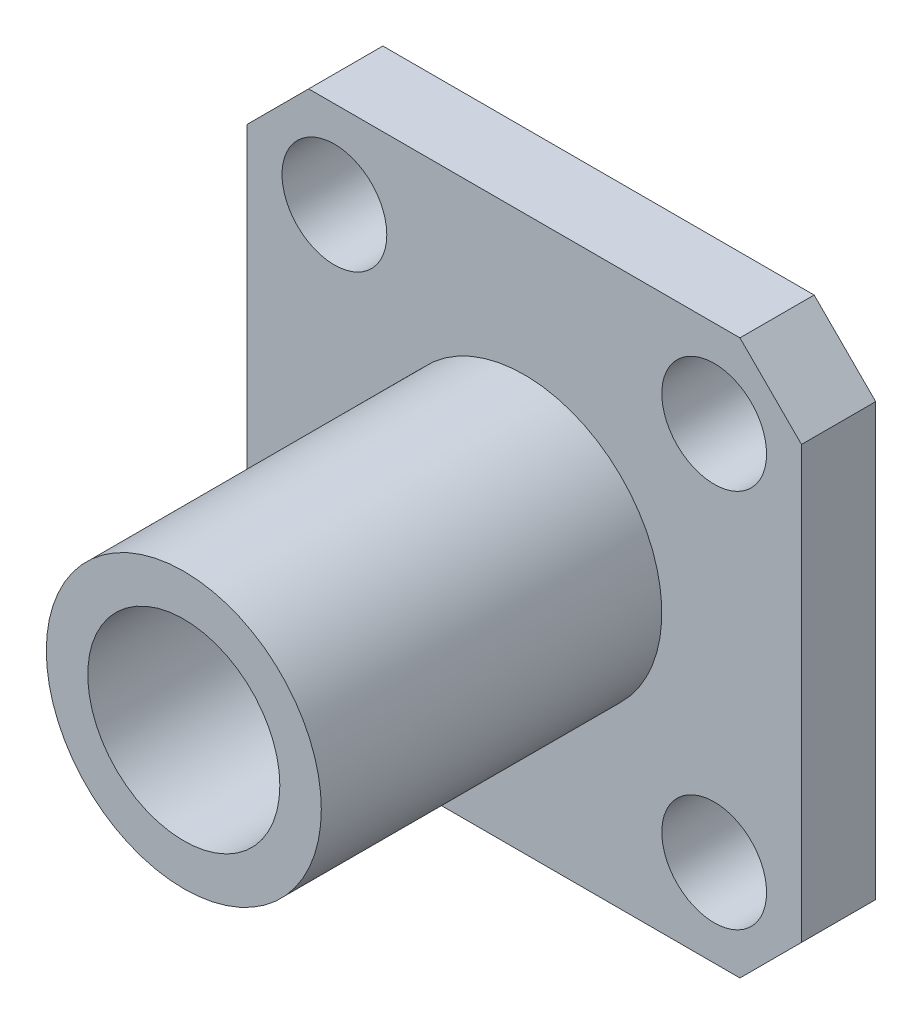
from build123d import *

# Parameters (mm, degrees)
SKETCH1_W           = 12.7
SKETCH1_H           = 12.7
BOSS_EXTRUDE1_DEPTH = 1.7
CHAMFER3_SIZE       = 1.41
SKETCH2_R           = 1.2
CUT_EXTRUDE2_DEPTH  = 10.139748355
SKETCH3_R           = 3.15
SKETCH3_R_2         = 2.2
BOSS_EXTRUDE2_DEPTH = 7.8
SKETCH4_R           = 0.64
BOSS_EXTRUDE3_DEPTH = 5


with BuildPart() as part:
    # Sketch1 → Boss-Extrude1 (new body)
    with BuildSketch(Plane(origin=(0, 0, 0), x_dir=(0, 1, 0), z_dir=(0, 0, 1))):
        Rectangle(SKETCH1_W, SKETCH1_H)
    extrude(amount=BOSS_EXTRUDE1_DEPTH)

    # Chamfer3
    chamfer3_edges = [part.edges().sort_by_distance(p)[0] for p in [
        (-6.35, 6.35, 0.85),
        (6.35, 6.35, 0.85),
        (6.35, -6.35, 0.85),
        (-6.35, -6.35, 0.85),
    ]]
    chamfer(chamfer3_edges, length=CHAMFER3_SIZE)

    # Sketch2 → Cut-Extrude2 (cut, through all)
    with BuildSketch(Plane.XY.offset(1.7)):
        with Locations((-4.35, 4.35)):
            Circle(SKETCH2_R)
        with Locations((-4.35, -4.35)):
            Circle(SKETCH2_R)
        with Locations((4.35, -4.35)):
            Circle(SKETCH2_R)
        with Locations((4.35, 4.35)):
            Circle(SKETCH2_R)
    extrude(amount=-CUT_EXTRUDE2_DEPTH, mode=Mode.SUBTRACT)

    # Sketch3 → Boss-Extrude2 (add)
    with BuildSketch(Plane.XY.offset(1.7)):
        Circle(SKETCH3_R)
        Circle(SKETCH3_R_2, mode=Mode.SUBTRACT)
    extrude(amount=BOSS_EXTRUDE2_DEPTH)

    # Sketch4 → Boss-Extrude3 (add)
    with BuildSketch(Plane(origin=(0, 0, 0), x_dir=(1, 0, 0), z_dir=(0, 0, -1))):
        Circle(SKETCH4_R)
    extrude(amount=BOSS_EXTRUDE3_DEPTH)


solid = part.part
